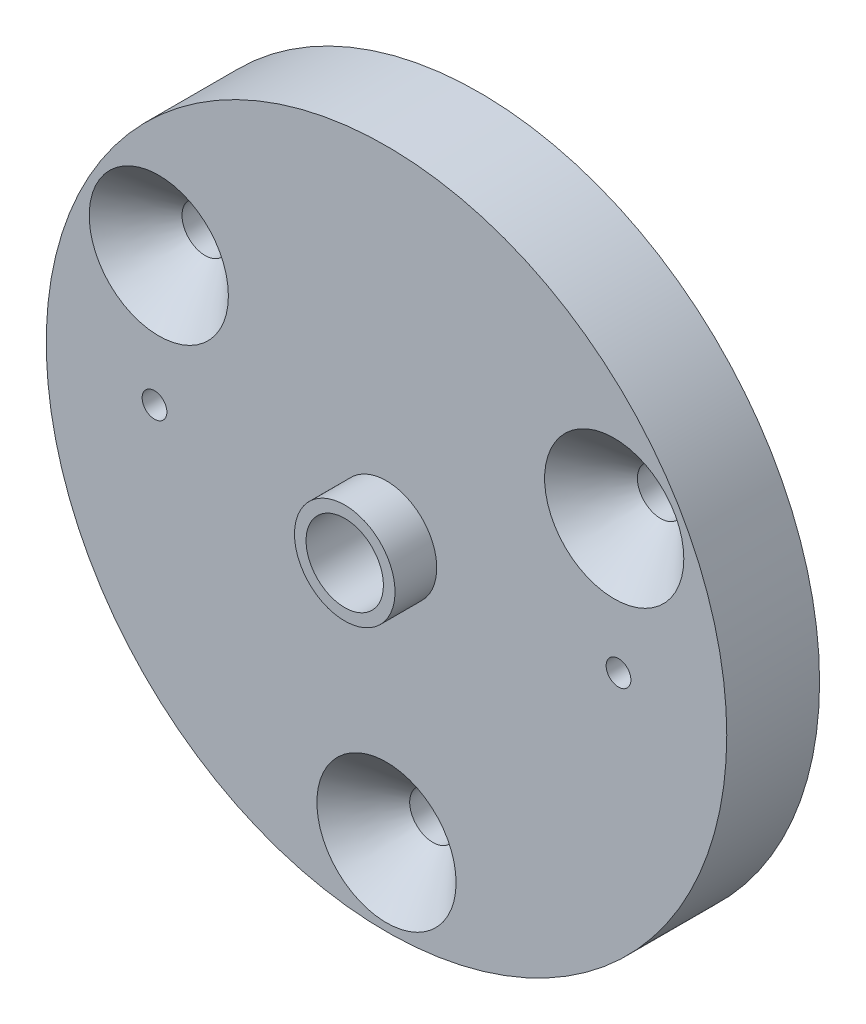
from build123d import *

# Parameters (mm, degrees)
SKETCH_1_R          = 22
EXTRUDE_1_DEPTH     = 6
SKETCH_2_R          = 3.25
EXTRUDE_2_DEPTH     = 2.7
SKETCH_3_R          = 2.5
CUT_EXTRUDE_1_DEPTH = 33.306191357
SKETCH_4_R          = 0.8
CUT_EXTRUDE_2_DEPTH = 32.685959036
SKETCH_5_R          = 13
CUT_EXTRUDE_3_DEPTH = 2
SKETCH_6_R          = 1.5
CUT_EXTRUDE_4_DEPTH = 32.685959036
CHAMFER_1_SIZE      = 3


with BuildPart() as part:
    # Эскиз1 → Бобышка-Вытянуть1 (new body)
    with BuildSketch(Plane.XY):
        Circle(SKETCH_1_R)
    extrude(amount=EXTRUDE_1_DEPTH)

    # Эскиз2 → Бобышка-Вытянуть2 (add)
    with BuildSketch(Plane.XY.offset(6)):
        Circle(SKETCH_2_R)
    extrude(amount=EXTRUDE_2_DEPTH)

    # Эскиз3 → Вырез-Вытянуть1 (cut, through all)
    with BuildSketch(Plane.XY.offset(8.7)):
        Circle(SKETCH_3_R)
    extrude(amount=-CUT_EXTRUDE_1_DEPTH, mode=Mode.SUBTRACT)

    # Эскиз4 → Вырез-Вытянуть2 (cut, through all)
    with BuildSketch(Plane.XY.offset(6)):
        with Locations((-15, 0)):
            Circle(SKETCH_4_R)
        with Locations((15, 0)):
            Circle(SKETCH_4_R)
    extrude(amount=-CUT_EXTRUDE_2_DEPTH, mode=Mode.SUBTRACT)

    # Эскиз5 → Вырез-Вытянуть3 (cut)
    with BuildSketch(Plane(origin=(0, 0, 0), x_dir=(-1, 0, 0), z_dir=(0, 0, -1))):
        Circle(SKETCH_5_R)
    extrude(amount=-CUT_EXTRUDE_3_DEPTH, mode=Mode.SUBTRACT)

    # Эскиз6 → Вырез-Вытянуть4 (cut, through all)
    with BuildSketch(Plane.XY.offset(6)):
        with Locations((0, -17)):
            Circle(SKETCH_6_R)
        with Locations((-14.722431864, 8.5)):
            Circle(SKETCH_6_R)
        with Locations((14.722431864, 8.5)):
            Circle(SKETCH_6_R)
    extrude(amount=-CUT_EXTRUDE_4_DEPTH, mode=Mode.SUBTRACT)

    # Фаска1
    chamfer_1_edges = [part.edges().sort_by_distance(p)[0] for p in [
        (-1.5, -17, 6),
        (13.222431864, 8.5, 6),
        (-16.222431864, 8.5, 6),
    ]]
    chamfer(chamfer_1_edges, length=CHAMFER_1_SIZE)


solid = part.part
